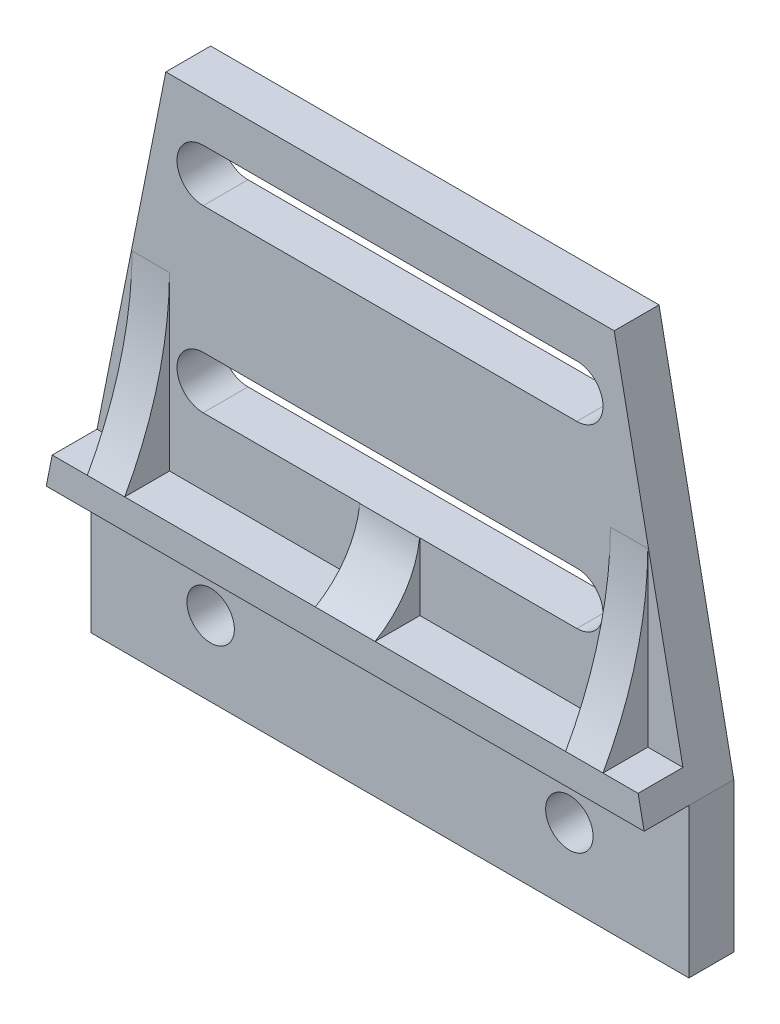
from build123d import *

# Parameters (mm, degrees)
SALIENTE_EXTRUIR1_DEPTH    = 3
SALIENTE_EXTRUIR2_DEPTH    = 3
NERVIO6_START              = -1.25
NERVIO6_DEPTH              = 2.5
NERVIO7_START              = -2
NERVIO7_DEPTH              = 4
CROQUIS3_R                 = 1.5875
CORTAR_EXTRUIR1_DEPTH      = 12
CORTAR_EXTRUIR2_DEPTH      = 10
CORTAR_EXTRUIR2_DEPTH_BACK = 12


# Read off the part's stored shape, not the designer's step: Nervio6, Nervio7
with BuildPart() as part:
    # Croquis1 → Saliente-Extruir1 (new body)
    with BuildSketch(Plane.XY):
        Polygon((-20, 5), (-20, -5), (20, -5), (20, 5), (0, 5), align=None)
        Polygon((-15, 30), (-20, 5), (0, 5), (0, 30), align=None)
        Polygon((0, 5), (20, 5), (15, 30), (0, 30), align=None)
    extrude(amount=SALIENTE_EXTRUIR1_DEPTH)

    # Croquis2 → Saliente-Extruir2 (add)
    with BuildSketch(Plane.XY.offset(3)):
        Polygon((-19.6, 7), (-20, 5), (20, 5), (19.6, 7), align=None)
    extrude(amount=SALIENTE_EXTRUIR2_DEPTH)

    # Nervio6 outline → Nervio6 (add)
    with BuildSketch(Plane(origin=(16, 0, 0), x_dir=(0, 0, -1), z_dir=(1, 0, 0)).offset(NERVIO6_START)):
        with BuildLine():
            Line((-3, 7), (-3, 18.5))
            ThreePointArc((-3, 18.5), (-3.776888017, 12.561362091), (-6, 7))
            Line((-6, 7), (-3, 7))
        make_face()
    nervio6 = extrude(amount=NERVIO6_DEPTH)

    # Simetría2: Nervio6 across plane
    add(nervio6.mirror(Plane(origin=(0, 0, 0), x_dir=(0, 0, 1), z_dir=(1, 0, 0))))

    # Nervio7 outline → Nervio7 (add)
    with BuildSketch(Plane(origin=(0, 0, 0), x_dir=(0, 0, -1), z_dir=(1, 0, 0)).offset(NERVIO7_START)):
        with BuildLine():
            Line((-3, 7), (-3, 11.670256173))
            ThreePointArc((-3, 11.670256173), (-3.927457039, 8.967347644), (-6, 7))
            Line((-6, 7), (-3, 7))
        make_face()
    extrude(amount=NERVIO7_DEPTH)

    # Croquis3 → Cortar-Extruir1 (cut)
    with BuildSketch(Plane.XY.offset(3)):
        with Locations((-12, 0)):
            Circle(CROQUIS3_R)
        with Locations((12, 0)):
            Circle(CROQUIS3_R)
    extrude(amount=-CORTAR_EXTRUIR1_DEPTH, mode=Mode.SUBTRACT)

    # Croquis4 → Cortar-Extruir2 (cut, two sides: drawn at the far end of the back side and taken through both)
    with BuildSketch(Plane.XY.offset(3).offset(-CORTAR_EXTRUIR2_DEPTH_BACK)):
        with BuildLine():
            Line((-12.5, 27), (12.5, 27))
            ThreePointArc((12.5, 27), (14.25, 25.25), (12.5, 23.5))
            Line((12.5, 23.5), (-12.5, 23.5))
            ThreePointArc((-12.5, 23.5), (-14.25, 25.25), (-12.5, 27))
        make_face()
        with BuildLine():
            Line((-12.5, 11.5), (12.5, 11.5))
            ThreePointArc((12.5, 11.5), (14.25, 13.25), (12.5, 15))
            Line((12.5, 15), (-12.5, 15))
            ThreePointArc((-12.5, 15), (-14.25, 13.25), (-12.5, 11.5))
        make_face()
    extrude(amount=CORTAR_EXTRUIR2_DEPTH + CORTAR_EXTRUIR2_DEPTH_BACK, mode=Mode.SUBTRACT)


solid = part.part
